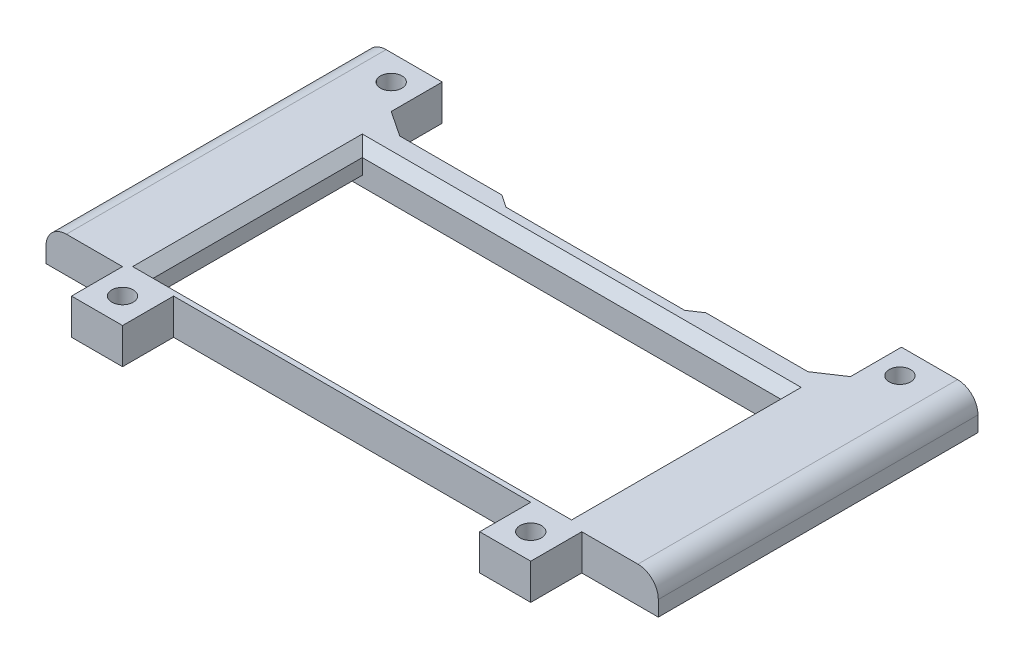
from build123d import *

# Parameters (mm, degrees)
SKETCH_1_R      = 2.1
SKETCH_1_W      = 92
SKETCH_1_H      = 41
EXTRUDE_2_DEPTH = 2
SKETCH_2_R      = 2.1
SKETCH_2_W      = 82.013427323
SKETCH_2_H      = 41
EXTRUDE_5_DEPTH = 5
CHAMFER_START   = 102.001425994
CHAMFER_1_DEPTH = 7
FILLET_1_R      = 4


with BuildPart() as part:
    # Эскиз1 → Бобышка-Вытянуть2 (new body)
    with BuildSketch(Plane(origin=(68.741769048, 102.001425994, 80.052702475), x_dir=(1, 0, 0), z_dir=(0, 1, 0))):
        Polygon((-60, -30), (-45, -30), (-45, -40), (-35, -40), (-35, -30), (35, -30), (35, -40), (45, -40), (45, -30), (60, -30), (60, 32.652702475), (45, 32.652702475), (45, 22.652702475), (55, 22.652702475), (55, 16), (-55, 16), (-55, 22.652702475), (-45, 22.652702475), (-45, 32.652702475), (-60, 32.652702475), align=None)
        with Locations(Location((-50, 27.652702475, 0), (0, 0, 180))):
            Circle(SKETCH_1_R, mode=Mode.SUBTRACT)
        with Locations(Location((49.694344906, 27.652702475, 0), (0, 0, 180))):
            Circle(SKETCH_1_R, mode=Mode.SUBTRACT)
        with Locations(Location((40, -35, 0), (0, 0, 180))):
            Circle(SKETCH_1_R, mode=Mode.SUBTRACT)
        with Locations(Location((-40, -35, 0), (0, 0, 180))):
            Circle(SKETCH_1_R, mode=Mode.SUBTRACT)
        with Locations((-1, -6.5)):
            Rectangle(SKETCH_1_W, SKETCH_1_H, mode=Mode.SUBTRACT)
    extrude(amount=EXTRUDE_2_DEPTH)

    # Эскиз2 → Бобышка-Вытянуть5 (add)
    with BuildSketch(Plane(origin=(0, 104.001425994, 0), x_dir=(1, 0, 0), z_dir=(0, 1, 0))):
        Polygon((23.741769048, -57.4), (23.741769048, -47.4), (8.741769048, -47.4), (8.741769048, -110.052702475), (23.741769048, -110.052702475), (23.741769048, -120.052702475), (33.741769048, -120.052702475), (33.741769048, -110.052702475), (103.741769048, -110.052702475), (103.741769048, -120.052702475), (113.741769048, -120.052702475), (113.741769048, -110.052702475), (128.741769048, -110.052702475), (128.741769048, -47.4), (113.741769048, -47.4), (113.741769048, -57.4), (123.741769048, -57.4), (123.741769048, -64.052702475), (13.741769048, -64.052702475), (13.741769048, -57.4), align=None)
        with Locations(Location((18.741769048, -52.4, 0), (0, 0, 180))):
            Circle(SKETCH_2_R, mode=Mode.SUBTRACT)
        with Locations(Location((118.436113954, -52.4, 0), (0, 0, 180))):
            Circle(SKETCH_2_R, mode=Mode.SUBTRACT)
        with Locations(Location((108.741769048, -115.052702475, 0), (0, 0, 180))):
            Circle(SKETCH_2_R, mode=Mode.SUBTRACT)
        with Locations(Location((28.741769048, -115.052702475, 0), (0, 0, 180))):
            Circle(SKETCH_2_R, mode=Mode.SUBTRACT)
        with Locations((67.735055387, -86.552702475)):
            Rectangle(SKETCH_2_W, SKETCH_2_H, mode=Mode.SUBTRACT)
    extrude(amount=EXTRUDE_5_DEPTH)

    # Фаска1: read off the stored shape, not the designer's step
    # Фаска1 outline → Фаска1 (add)
    with BuildSketch(Plane(origin=(0, 0, 0), x_dir=(1, 0, 0), z_dir=(0, 1, 0)).offset(CHAMFER_START)):
        Polygon((28.741769048, -60.726351237), (23.741769048, -57.4), (13.741769048, -57.4), (13.741769048, -64.052702475), (123.741769048, -64.052702475), (123.741769048, -57.4), (113.741769048, -57.4), (108.741769048, -60.726351237), (88.741769048, -60.726351237), (86.241769048, -62.389526856), (51.241769048, -62.389526856), (48.741769048, -60.726351237), align=None)
    extrude(amount=CHAMFER_1_DEPTH)

    # Chamfer 1 2: loft between two sections, ruled curve by curve
    chamfer_1_2_from = [
        Edge.make_line((26.728341725, 107.001425994, 66.052702475), (26.728341725, 107.001425994, 107.052702475)),
        Edge.make_line((26.728341725, 107.001425994, 107.052702475), (108.741769048, 107.001425994, 107.052702475)),
        Edge.make_line((26.728341725, 107.001425994, 66.052702475), (108.741769048, 107.001425994, 66.052702475)),
        Edge.make_line((108.741769048, 107.001425994, 107.052702475), (108.741769048, 107.001425994, 66.052702475)),
    ]
    chamfer_1_2_to = [
        Edge.make_line((24.728341725, 109.001425994, 64.052702475), (24.728341725, 109.001425994, 109.052702475)),
        Edge.make_line((24.728341725, 109.001425994, 109.052702475), (110.741769048, 109.001425994, 109.052702475)),
        Edge.make_line((24.728341725, 109.001425994, 64.052702475), (110.741769048, 109.001425994, 64.052702475)),
        Edge.make_line((110.741769048, 109.001425994, 109.052702475), (110.741769048, 109.001425994, 64.052702475)),
    ]
    chamfer_1_2 = Solid(Shell([*[Face.make_surface_from_curves(chamfer_1_2_from[k], chamfer_1_2_to[k]) for k in range(4)], Face(Wire(chamfer_1_2_from)), Face(Wire(chamfer_1_2_to))]))
    add(chamfer_1_2, mode=Mode.SUBTRACT)

    # Скругление1
    fillet_1_edges = [part.edges().sort_by_distance(p)[0] for p in [
        (8.741769048, 109.001425994, 78.726351237),
        (128.741769048, 109.001425994, 78.726351237),
    ]]
    fillet(fillet_1_edges, radius=FILLET_1_R)


solid = part.part
